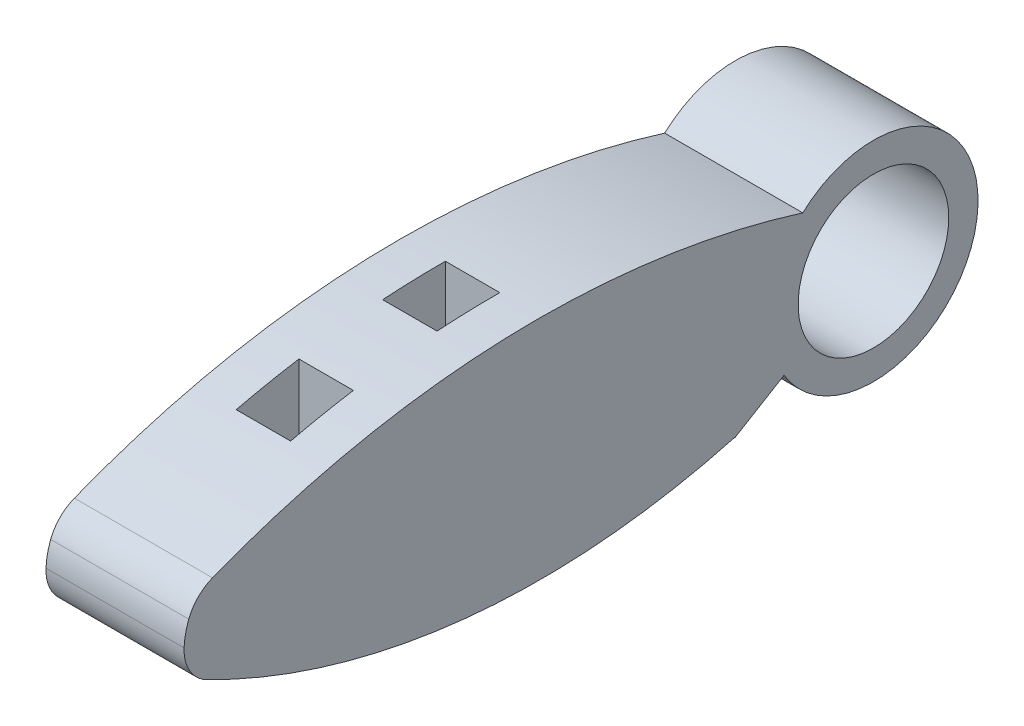
from build123d import *

# Parameters (mm, degrees)
SKETCH1_R               = 6.35
BOSS_EXTRUDE1_DEPTH     = 8.382
SKETCH6_W               = 8.382
SKETCH6_H               = 10.16
BOSS_EXTRUDE2_DEPTH     = 31.75
CUT_EXTRUDE4_DEPTH      = 37.592
BOSS_EXTRUDE3_START     = -8.382
BOSS_EXTRUDE3_DEPTH     = 8.382
BOSS_EXTRUDE4_START     = -8.382
SKETCH11_R              = 6.35
BOSS_EXTRUDE4_DEPTH     = 8.382
FILLET1_R               = 2.54
CUT_EXTRUDE5_DEPTH      = 12.192
CUT_EXTRUDE6_DEPTH      = 2.54
CUT_EXTRUDE6_DEPTH_BACK = 45.396714307
SKETCH13_W              = 3.302
SKETCH13_H              = 3.81
CUT_EXTRUDE7_DEPTH      = 5.842
CUT_EXTRUDE7_DEPTH_BACK = 2.032
SKETCH14_W              = 2.286
SKETCH14_H              = 39.733795437
BOSS_EXTRUDE5_DEPTH     = 2.286
SKETCH19_R              = 4.572
CUT_EXTRUDE8_DEPTH      = 20.32
CHAMFER1_SIZE           = 2.54
CHAMFER1_SIZE_2         = 1.929900828


with BuildPart() as part:
    # Sketch1 → Boss-Extrude1 (new body)
    with BuildSketch(Plane(origin=(0, 0, 0), x_dir=(0, 0, -1), z_dir=(1, 0, 0))):
        Circle(SKETCH1_R)
    extrude(amount=BOSS_EXTRUDE1_DEPTH)

    # Sketch6 → Boss-Extrude2 (add)
    with BuildSketch(Plane.XY):
        with Locations((4.191, 0)):
            Rectangle(SKETCH6_W, SKETCH6_H)
    extrude(amount=BOSS_EXTRUDE2_DEPTH)

    # Sketch9 → Cut-Extrude4 (cut)
    with BuildSketch(Plane.ZY):
        with BuildLine():
            Line((31.75, 5.08), (11.408365483, 5.08))
            Line((11.408365483, 5.08), (3.81, 5.08))
            ThreePointArc((3.81, 5.08), (5.339430543, 3.232524289), (6.092803339, 0.955518862))
            Line((6.092803339, 0.955518862), (11.408365483, 0.955518862))
            Line((11.408365483, 0.955518862), (11.408365483, -5.08))
            Line((11.408365483, -5.08), (31.75, -5.08))
            Line((31.75, -5.08), (31.75, 5.08))
        make_face()
    extrude(amount=-CUT_EXTRUDE4_DEPTH, mode=Mode.SUBTRACT)

    # Sketch8 → Boss-Extrude3 (add)
    with BuildSketch(Plane(origin=(8.382, 0, 0), x_dir=(0, 0, -1), z_dir=(1, 0, 0)).offset(BOSS_EXTRUDE3_START)):
        with BuildLine():
            ThreePointArc((-4.292149369, 4.679738646), (-6.310240248, 0.709484333), (-5.22417178, -3.609782433))
            ThreePointArc((-5.22417178, -3.609782433), (-6.393298566, -4.253843839), (-7.59869899, -4.827152092))
            ThreePointArc((-7.59869899, -4.827152092), (-24.920173533, -6.389046133), (-41.525963587, -1.219836328))
            ThreePointArc((-41.525963587, -1.219836328), (-41.809620195, 1.017710808), (-40.915378479, 3.088317002))
            ThreePointArc((-40.915378479, 3.088317002), (-22.743048705, 7.089374731), (-4.292149369, 4.679738646))
        make_face()
    extrude(amount=BOSS_EXTRUDE3_DEPTH)

    # Sketch11 → Boss-Extrude4 (add)
    with BuildSketch(Plane(origin=(8.382, 0, 0), x_dir=(0, 0, -1), z_dir=(1, 0, 0)).offset(BOSS_EXTRUDE4_START)):
        Circle(SKETCH11_R)
    extrude(amount=BOSS_EXTRUDE4_DEPTH)

    # Fillet1
    fillet1_edges = [part.edges().sort_by_distance(p)[0] for p in [
        (4.191, -1.219836328, 41.525963587),
        (4.191, 3.088317002, 40.915378479),
    ]]
    fillet(fillet1_edges, radius=FILLET1_R)

    # Sketch12 → Cut-Extrude5 (cut)
    with BuildSketch(Plane.ZY):
        with BuildLine():
            Line((5.311349681, -3.480239153), (6.475883823, -5.08))
            Line((6.475883823, -5.08), (3.81, -5.08))
            ThreePointArc((3.81, -5.08), (4.630287647, -4.345450069), (5.311349681, -3.480239153))
        make_face()
    extrude(amount=-CUT_EXTRUDE5_DEPTH, mode=Mode.SUBTRACT)

    # Sketch13 → Cut-Extrude6 (cut, two sides: drawn at the far end of the back side and taken through both)
    with BuildSketch(Plane.XZ.offset(5.08).offset(-CUT_EXTRUDE6_DEPTH_BACK)):
        with Locations((4.191, 30.937666225)):
            Rectangle(SKETCH13_W, SKETCH13_H)
        with Locations((4.191, 22.047666225)):
            Rectangle(SKETCH13_W, SKETCH13_H)
    extrude(amount=CUT_EXTRUDE6_DEPTH + CUT_EXTRUDE6_DEPTH_BACK, mode=Mode.SUBTRACT)

    # Sketch14 → Cut-Extrude7 (cut, two sides: drawn at the far end of the back side and taken through both)
    with BuildSketch(Plane.XZ.offset(5.08).offset(-CUT_EXTRUDE7_DEPTH_BACK)):
        with Locations((4.191, 9.165768507)):
            Rectangle(SKETCH14_W, SKETCH14_H)
    extrude(amount=CUT_EXTRUDE7_DEPTH + CUT_EXTRUDE7_DEPTH_BACK, mode=Mode.SUBTRACT)

    # Sketch15 → Boss-Extrude5 (add)
    with BuildSketch(Plane.ZY.offset(-5.334)):
        with BuildLine():
            Line((20.142666225, -3.048), (5.311349681, -4.064))
            ThreePointArc((5.311349681, -4.064), (0.047585795, -5.585594771), (-4.808654899, -3.048))
            Line((-4.808654899, -3.048), (20.142666225, -3.048))
        make_face()
    extrude(amount=BOSS_EXTRUDE5_DEPTH)

    # Sketch19 → Cut-Extrude8 (cut)
    with BuildSketch(Plane(origin=(8.382, 0, 0), x_dir=(0, 0, -1), z_dir=(1, 0, 0))):
        Circle(SKETCH19_R)
    extrude(amount=-CUT_EXTRUDE8_DEPTH, mode=Mode.SUBTRACT)

    # Chamfer1
    # the kernel refuses this chamfer: 2.54, 1.929900828 mm, written as the material it takes off along each edge
    with BuildSketch(Plane(origin=(-6.584556216, -5.08, 6.475883823), x_dir=(0, 0.7995159790431987, -0.6006448195519506), z_dir=(1, 0, 0))) as chamfer1_piece_1_section:
        Polygon((CHAMFER1_SIZE * 0.999886403459, CHAMFER1_SIZE * 0.0150724974299), (-CHAMFER1_SIZE_2 * 0.600644819472, CHAMFER1_SIZE_2 * 0.799515978937), (0, 0), align=None)
    chamfer1_piece_1 = extrude(amount=9.632556216, mode=Mode.PRIVATE)
    chamfer1_piece_1 = chamfer1_piece_1 - Plane(origin=(1.524, 0, 0), x_dir=(0, -0.800000000000003, 0.5999999999999959), z_dir=(-1, 0, 0)) * Cylinder(6.35, 30, mode=Mode.PRIVATE)
    add(chamfer1_piece_1, mode=Mode.SUBTRACT)
    with BuildSketch(Plane(origin=(-6.584556216, -5.08, 6.475883823), x_dir=(0, 0.7995159790431987, -0.6006448195519506), z_dir=(1, 0, 0))) as chamfer1_piece_2_section:
        Polygon((CHAMFER1_SIZE * 0.999886403459, CHAMFER1_SIZE * 0.0150724974299), (-CHAMFER1_SIZE_2 * 0.600644819472, CHAMFER1_SIZE_2 * 0.799515978937), (0, 0), align=None)
    chamfer1_piece_2 = extrude(amount=16.217112431, mode=Mode.PRIVATE)
    chamfer1_piece_2 = chamfer1_piece_2 - Plane(origin=(6.858, 0, 0), x_dir=(0, -0.800000000000003, 0.5999999999999959), z_dir=(-1, 0, 0)) * Cylinder(6.35, 43, mode=Mode.PRIVATE)
    chamfer1_piece_2 = split(chamfer1_piece_2, bisect_by=Plane(origin=(5.334, -3.740270515, 5.829817166), z_dir=(1, 0, 0)), keep=Keep.TOP, mode=Mode.PRIVATE)
    add(chamfer1_piece_2, mode=Mode.SUBTRACT)
    with BuildSketch(Plane(origin=(-1.250556216, -5.08, 6.475883823), x_dir=(0, 0.7995159790431987, -0.6006448195519506), z_dir=(1, 0, 0))) as chamfer1_piece_3_section:
        Polygon((CHAMFER1_SIZE * 0.999886403459, CHAMFER1_SIZE * 0.0150724974299), (-CHAMFER1_SIZE_2 * 0.600644819472, CHAMFER1_SIZE_2 * 0.799515978937), (0, 0), align=None)
    chamfer1_piece_3 = extrude(amount=16.217112431, mode=Mode.PRIVATE)
    chamfer1_piece_3 = chamfer1_piece_3 - Plane(origin=(1.524, 0, 0), x_dir=(0, -0.800000000000003, 0.5999999999999959), z_dir=(-1, 0, 0)) * Cylinder(6.35, 43, mode=Mode.PRIVATE)
    chamfer1_piece_3 = split(chamfer1_piece_3, bisect_by=Plane(origin=(3.048, -3.740270515, 5.829817166), z_dir=(-1, 0, 0)), keep=Keep.TOP, mode=Mode.PRIVATE)
    add(chamfer1_piece_3, mode=Mode.SUBTRACT)
    with BuildSketch(Plane(origin=(5.334, -5.08, 6.475883823), x_dir=(0, 0.7995159790431987, -0.6006448195519506), z_dir=(1, 0, 0))) as chamfer1_piece_4_section:
        Polygon((CHAMFER1_SIZE * 0.999886403459, CHAMFER1_SIZE * 0.0150724974299), (-CHAMFER1_SIZE_2 * 0.600644819472, CHAMFER1_SIZE_2 * 0.799515978937), (0, 0), align=None)
    chamfer1_piece_4 = extrude(amount=9.632556216, mode=Mode.PRIVATE)
    chamfer1_piece_4 = chamfer1_piece_4 - Plane(origin=(6.858, 0, 0), x_dir=(0, -0.800000000000003, 0.5999999999999959), z_dir=(-1, 0, 0)) * Cylinder(6.35, 30, mode=Mode.PRIVATE)
    add(chamfer1_piece_4, mode=Mode.SUBTRACT)


solid = part.part
